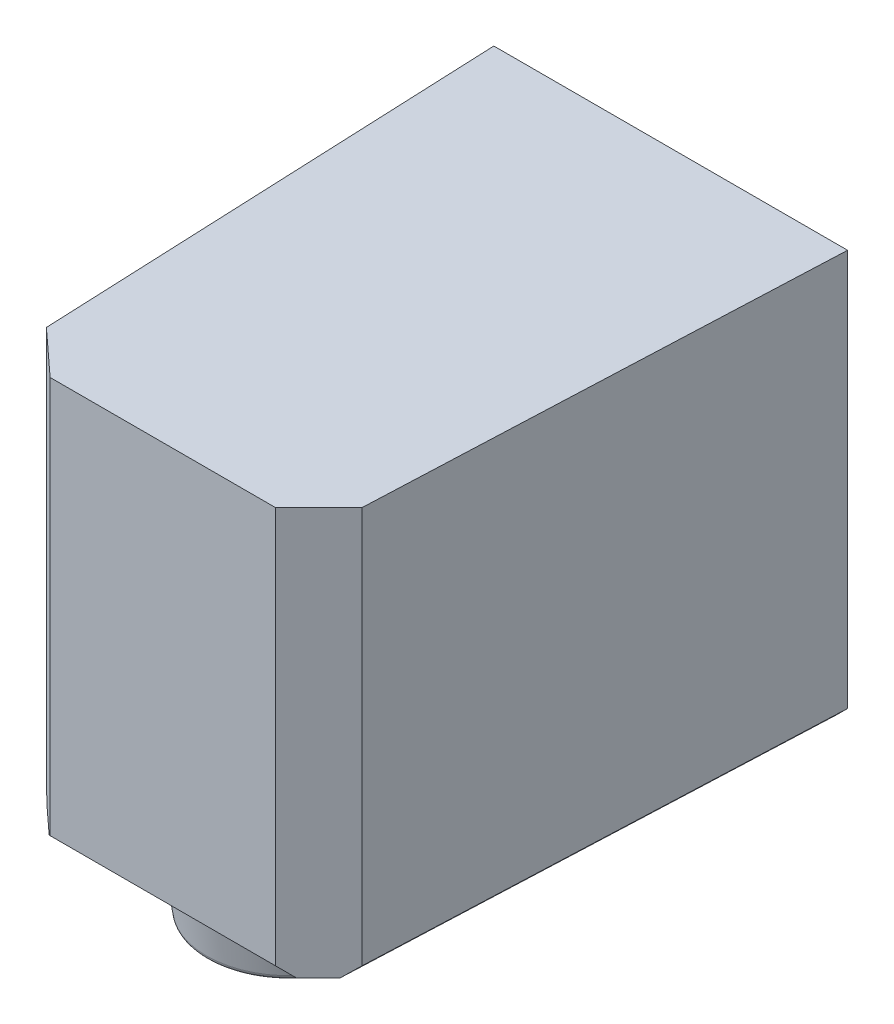
from build123d import *

# Parameters (mm, degrees)
BOSS_EXTRUDE1_DEPTH = 78.5
SKETCH4_R           = 17.5
BOSS_EXTRUDE2_DEPTH = 12.5
BOSS_EXTRUDE2_TAPER = 8
FILLET1_R           = 1
FILLET2_R           = 1
CHAMFER1_SIZE       = 2
CHAMFER2_SIZE       = 8
CHAMFER2_SIZE_2     = 8.365483885


with BuildPart() as part:
    # Sketch1 → Boss-Extrude1 (new body)
    with BuildSketch(Plane(origin=(0, 0, 0), x_dir=(1, 0, 0), z_dir=(0, 1, 0))):
        Polygon((0, 0), (68.2, 0), (64, -98.1), (4.2, -98.1), align=None)
    extrude(amount=BOSS_EXTRUDE1_DEPTH)

    # Sketch4 → Boss-Extrude2 (add)
    with BuildSketch(Plane.XZ):
        with Locations((34.1, 73.6)):
            Circle(SKETCH4_R)
    extrude(amount=BOSS_EXTRUDE2_DEPTH, taper=BOSS_EXTRUDE2_TAPER)

    # Fillet1
    fillet1_edges = [part.edges().sort_by_distance(p)[0] for p in [
        (18.356760434, -12.5, 73.6),
    ]]
    fillet(fillet1_edges, radius=FILLET1_R)

    # Fillet2
    fillet2_edges = [part.edges().sort_by_distance(p)[0] for p in [
        (16.6, 0, 73.6),
    ]]
    fillet(fillet2_edges, radius=FILLET2_R)

    # Chamfer1
    chamfer1_edges = [part.edges().sort_by_distance(p)[0] for p in [
        (66.1, 0, 49.05),
        (34.1, 0, 98.1),
        (2.1, 0, 49.05),
    ]]
    chamfer(chamfer1_edges, length=CHAMFER1_SIZE)

    # Chamfer2
    # the kernel refuses this chamfer: 8.365483885, 8 mm, written as the material it takes off along each edge
    with BuildSketch(Plane(origin=(4.2, -19.537429792, 98.1), x_dir=(-0.07144532061930704, 0, -0.9974445178362575), z_dir=(0, 1, 0))) as chamfer2_piece_1:
        Polygon((CHAMFER2_SIZE * 0.999587640261, -CHAMFER2_SIZE * 0.028714968879), (-CHAMFER2_SIZE_2 * 0.071445320615, -CHAMFER2_SIZE_2 * 0.997444517777), (0, 0), align=None)
    extrude(amount=119.574859584, mode=Mode.SUBTRACT)
    with BuildSketch(Plane(origin=(64, -19.537429792, 98.1), x_dir=(0.06900069983757576, 0, -0.9976166114404496), z_dir=(0, 1, 0))) as chamfer2_piece_2:
        Polygon((CHAMFER2_SIZE_2 * 0.999655009427, CHAMFER2_SIZE_2 * 0.0262652243269), (-CHAMFER2_SIZE * 0.0690006998376, CHAMFER2_SIZE * 0.99761661144), (0, 0), align=None)
    extrude(amount=119.574859584, mode=Mode.SUBTRACT)


solid = part.part
